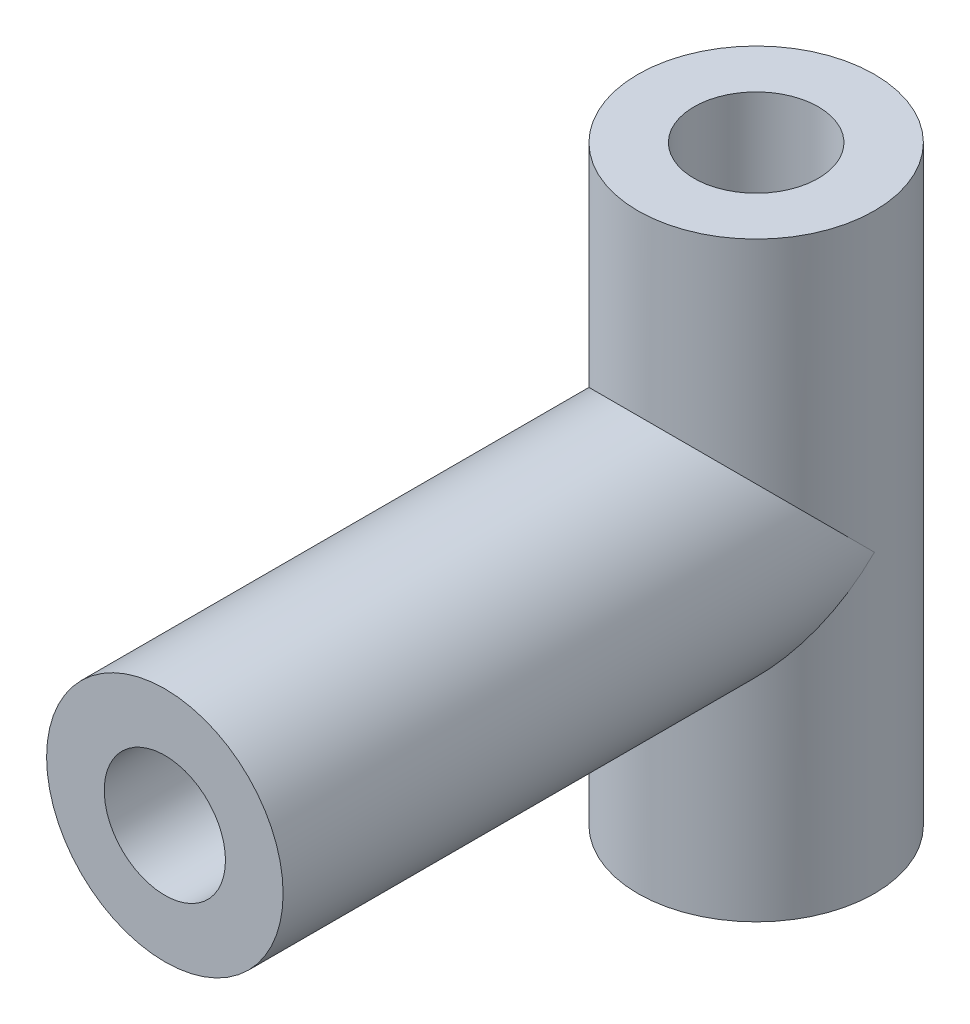
from build123d import *

# Parameters (mm, degrees)
SKETCH_1_R          = 4
EXTRUDE_1_DEPTH     = 10
SKETCH_2_R          = 4
EXTRUDE_2_DEPTH     = 20
SKETCH_3_R          = 2.05
CUT_EXTRUDE_1_DEPTH = 15
SKETCH_4_R          = 2.1
CUT_EXTRUDE_2_DEPTH = 29.565713714


with BuildPart() as part:
    # 草圖1 → 填料-伸長1 (new, symmetric)
    with BuildSketch(Plane(origin=(0, 0, 0), x_dir=(1, 0, 0), z_dir=(0, 1, 0))):
        Circle(SKETCH_1_R)
    extrude(amount=EXTRUDE_1_DEPTH, both=True)

    # 草圖2 → 填料-伸長2 (add)
    with BuildSketch(Plane.XY):
        Circle(SKETCH_2_R)
    extrude(amount=EXTRUDE_2_DEPTH)

    # 草圖3 → 除料-伸長1 (cut)
    with BuildSketch(Plane.XY.offset(20)):
        Circle(SKETCH_3_R)
    extrude(amount=-CUT_EXTRUDE_1_DEPTH, mode=Mode.SUBTRACT)

    # 草圖4 → 除料-伸長2 (cut, through all)
    with BuildSketch(Plane.XZ.offset(10)):
        Circle(SKETCH_4_R)
    extrude(amount=-CUT_EXTRUDE_2_DEPTH, mode=Mode.SUBTRACT)


solid = part.part
